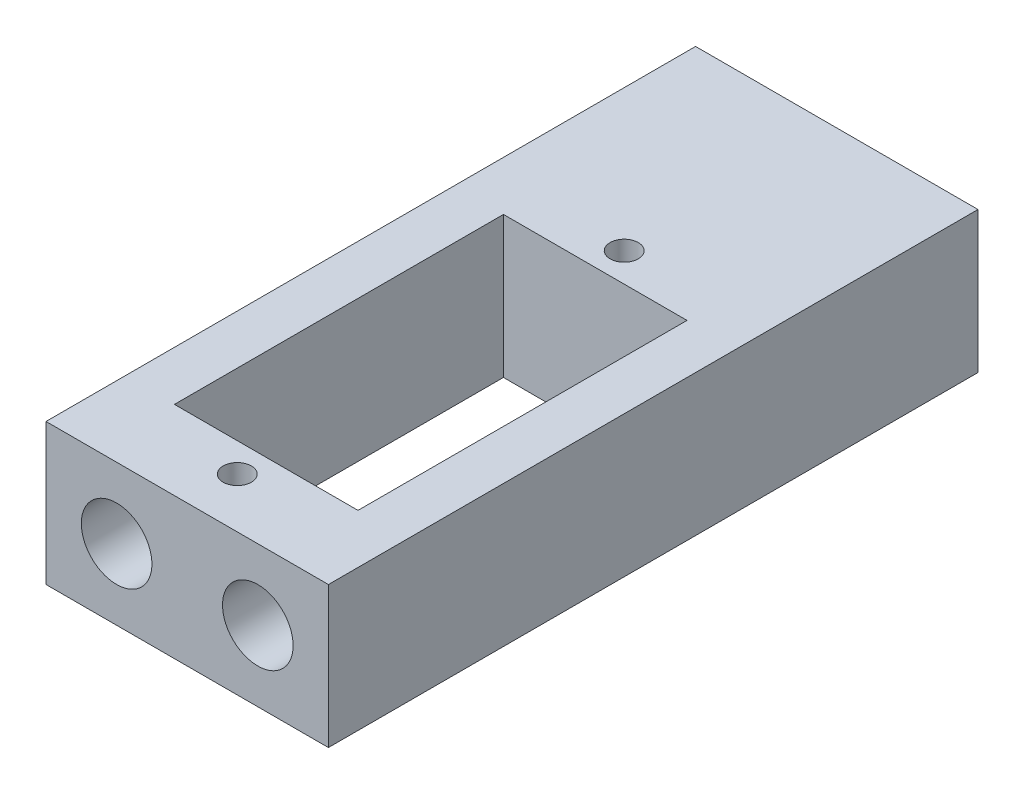
from build123d import *

# Parameters (mm, degrees)
SKETCH1_W           = 20
SKETCH1_H           = 46
BOSS_EXTRUDE1_DEPTH = 10
SKETCH2_R           = 1
SKETCH2_W           = 13
SKETCH2_H           = 23.3
CUT_EXTRUDE1_DEPTH  = 28
SKETCH3_R           = 2.5
CUT_EXTRUDE2_DEPTH  = 4
CUT_EXTRUDE3_START  = -4
SKETCH4_R           = 2.5
CUT_EXTRUDE3_DEPTH  = 4


with BuildPart() as part:
    # Sketch1 → Boss-Extrude1 (new body)
    with BuildSketch(Plane(origin=(0, 0, 0), x_dir=(1, 0, 0), z_dir=(0, 1, 0))):
        Rectangle(SKETCH1_W, SKETCH1_H)
    extrude(amount=BOSS_EXTRUDE1_DEPTH)

    # Sketch2 → Cut-Extrude1 (cut, through all)
    with BuildSketch(Plane(origin=(0, 10, 0), x_dir=(1, 0, 0), z_dir=(0, 1, 0))):
        with Locations((0, 7.945)):
            Circle(SKETCH2_R)
        with Locations((0, -19.455)):
            Circle(SKETCH2_R)
        with Locations((0, -5.755)):
            Rectangle(SKETCH2_W, SKETCH2_H)
    extrude(amount=-CUT_EXTRUDE1_DEPTH, mode=Mode.SUBTRACT)

    # Sketch3 → Cut-Extrude2 (cut)
    with BuildSketch(Plane(origin=(0, 0, -23), x_dir=(-1, 0, 0), z_dir=(0, 0, -1))):
        with Locations((5, 5)):
            Circle(SKETCH3_R)
        with Locations((-5, 5)):
            Circle(SKETCH3_R)
    extrude(amount=-CUT_EXTRUDE2_DEPTH, mode=Mode.SUBTRACT)

    # Sketch4 → Cut-Extrude3 (cut)
    with BuildSketch(Plane.XY.offset(23).offset(CUT_EXTRUDE3_START)):
        with Locations((5, 5)):
            Circle(SKETCH4_R)
        with Locations((-5, 5)):
            Circle(SKETCH4_R)
    extrude(amount=CUT_EXTRUDE3_DEPTH, mode=Mode.SUBTRACT)


solid = part.part
